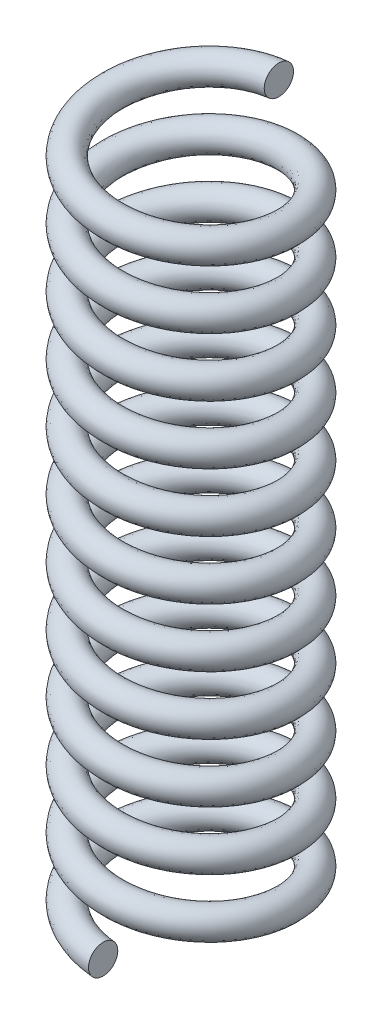
from build123d import *

# Parameters (mm, degrees)
SWEEP_1_PITCH  = 2
SWEEP_1_HEIGHT = 23
SWEEP_1_RADIUS = 3
SKETCH_7_R     = 0.5


with BuildPart() as part:
    # 扫描1: sweep along a helix
    with BuildLine() as sweep_1_path:
        Helix(SWEEP_1_PITCH, SWEEP_1_HEIGHT, SWEEP_1_RADIUS, center=(0, 0, 0), direction=(0, 1, 0), lefthand=True)
    # 草图7 → 扫描1 (sweep)
    with BuildSketch(Plane(origin=(0, 0, 0), x_dir=(0, 0, -1), z_dir=(1, 0, 0))):
        with Locations((-3, 0)):
            Circle(SKETCH_7_R)
    sweep(path=sweep_1_path.line, is_frenet=True)


solid = part.part
